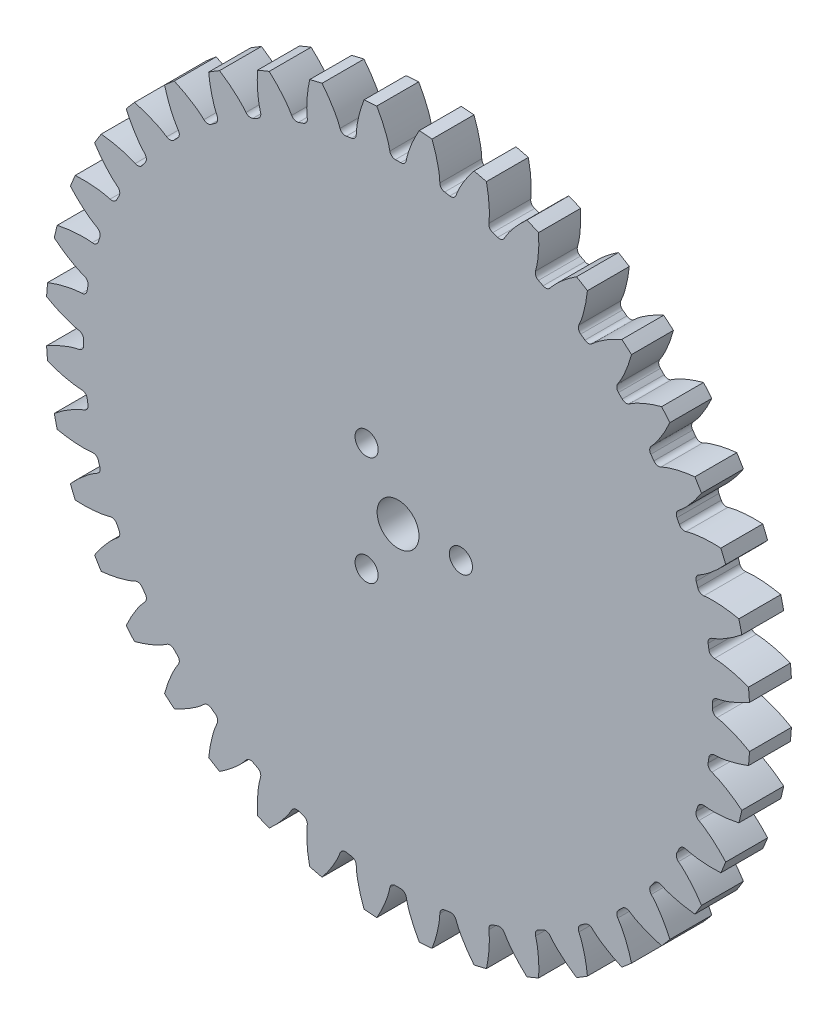
from build123d import *

# Parameters (mm, degrees)
BOSS_EXTRUDE1_DEPTH      = 3.175
BOSS_EXTRUDE1_DEPTH_BACK = 3.175
SKETCH3_R                = 53.34
CUT_EXTRUDE1_DEPTH       = 76.500939233
FILLET1_R                = 0.852182791
CIRPATTERN1_COUNT        = 40
FILLET1_OF_CIRPATTERN1_R = 0.852182791
SKETCH6_R                = 1.750000056
CUT_EXTRUDE2_DEPTH       = 76.56374835
SKETCH7_R                = 3.175
CUT_EXTRUDE3_DEPTH       = 76.56374835


with BuildPart() as part:
    # Sketch3 → Boss-Extrude1 (new, two sides: drawn at the far end of the back side and taken through both)
    with BuildSketch(Plane.XY.offset(-BOSS_EXTRUDE1_DEPTH_BACK)):
        Circle(SKETCH3_R)
    extrude(amount=BOSS_EXTRUDE1_DEPTH + BOSS_EXTRUDE1_DEPTH_BACK)

    # Sketch4 → Cut-Extrude1 (cut, symmetric)
    with BuildSketch(Plane.XY):
        with BuildLine():
            Line((47.610863724, 1.16029328), (47.722215798, 1.163006969))
            add(Edge.make_bspline(
                [(47.722215798, 1.163006969), (47.730982789, 1.163313167), (47.755564012, 1.16445845), (47.80200305, 1.167754997), (47.87772523, 1.174741096), (47.974119041, 1.186004909), (48.098593622, 1.203276497), (48.245061479, 1.227112329), (48.405834144, 1.256963367), (48.580520514, 1.293386204), (48.754577285, 1.333212779), (48.927987969, 1.376189951), (49.100522746, 1.421931459), (49.30925176, 1.48080125), (49.559155717, 1.556203831), (49.850651678, 1.651349023), (50.180503564, 1.767531099), (50.515821541, 1.894787282), (50.845048793, 2.027276114), (51.176798745, 2.169495413), (51.497150175, 2.313020498), (51.828924093, 2.470658837), (52.134675109, 2.620519189), (52.476090794, 2.797888155), (52.751288045, 2.94379105), (53.034579939, 3.102405155), (53.172312998, 3.180768911), (53.242640535, 3.221308569)],
                knots=[0, 0, 0, 0, 0, 0.005376749, 0.015083688, 0.02853182, 0.04661014, 0.064854849, 0.092110526, 0.119476176, 0.146842496, 0.174208854, 0.201574956, 0.228941013, 0.256307345, 0.307035032, 0.361767352, 0.416499661, 0.471231937, 0.525964282, 0.580696616, 0.635428982, 0.690161387, 0.744893688, 0.799626082, 0.854358407, 0.909090914, 0.909090914, 0.909090914, 0.909090914, 0.909090914], degree=4))
            ThreePointArc((53.242640535, 3.221308569), (53.34, 0), (53.242640535, -3.221308569))
            add(Edge.make_bspline(
                [(47.722215798, -1.163006969), (47.730982789, -1.163313167), (47.755564012, -1.16445845), (47.80200305, -1.167754997), (47.87772523, -1.174741096), (47.974119041, -1.186004909), (48.098593622, -1.203276497), (48.245061479, -1.227112329), (48.405834144, -1.256963367), (48.580520514, -1.293386204), (48.754577285, -1.333212779), (48.927987969, -1.376189951), (49.100522746, -1.421931459), (49.30925176, -1.48080125), (49.559155717, -1.556203831), (49.850651678, -1.651349023), (50.180503564, -1.767531099), (50.515821541, -1.894787282), (50.845048793, -2.027276114), (51.176798745, -2.169495413), (51.497150175, -2.313020498), (51.828924093, -2.470658837), (52.134675109, -2.620519189), (52.476090794, -2.797888155), (52.751288045, -2.94379105), (53.034579939, -3.102405155), (53.172312998, -3.180768911), (53.242640535, -3.221308569)],
                knots=[0, 0, 0, 0, 0, 0.005376749, 0.015083688, 0.02853182, 0.04661014, 0.064854849, 0.092110526, 0.119476176, 0.146842496, 0.174208854, 0.201574956, 0.228941013, 0.256307345, 0.307035032, 0.361767352, 0.416499661, 0.471231937, 0.525964282, 0.580696616, 0.635428982, 0.690161387, 0.744893688, 0.799626082, 0.854358407, 0.909090914, 0.909090914, 0.909090914, 0.909090914, 0.909090914], degree=4))
            Line((47.722215798, -1.163006969), (47.610863724, -1.16029328))
            ThreePointArc((47.610863724, -1.16029328), (47.625, 0), (47.610863724, 1.16029328))
        make_face()
    cut_extrude1 = extrude(amount=CUT_EXTRUDE1_DEPTH, both=True, mode=Mode.SUBTRACT)

    # Fillet1
    fillet1_edges = [part.edges().sort_by_distance(p)[0] for p in [
        (47.610863724, -1.16029328, 0),
        (47.610863724, 1.16029328, 0),
    ]]
    fillet(fillet1_edges, radius=FILLET1_R)

    # CirPattern1: Cut-Extrude1 ×40 about axis
    cirpattern1_axis = Axis((0, 0, 3.175), (0, 0, -1))
    for i in range(1, CIRPATTERN1_COUNT):
        add(cut_extrude1.rotate(cirpattern1_axis, i * 360 / CIRPATTERN1_COUNT), mode=Mode.SUBTRACT)

    # Fillet1 of CirPattern1
    fillet1_of_cirpattern1_edges = [part.edges().sort_by_distance(p)[0] for p in [
        (46.843185127, -8.593988141, 0),
        (47.206204844, -6.301971852, 0),
        (44.922071849, -15.816070492, 0),
        (45.639172533, -13.609061523, 0),
        (41.894828074, -22.648708697, 0),
        (42.948352326, -20.581050932, 0),
        (37.835994591, -28.923660528, 0),
        (39.200001148, -27.046266564, 0),
        (32.845513351, -34.486415844, 0),
        (34.486415844, -32.845513351, 0),
        (27.046266564, -39.200001148, 0),
        (28.923660528, -37.835994591, 0),
        (20.581050932, -42.948352326, 0),
        (22.648708697, -41.894828074, 0),
        (13.609061523, -45.639172533, 0),
        (15.816070492, -44.922071849, 0),
        (6.301971852, -47.206204844, 0),
        (8.593988141, -46.843185127, 0),
        (-1.16029328, -47.610863724, 0),
        (1.16029328, -47.610863724, 0),
        (-8.593988141, -46.843185127, 0),
        (-6.301971852, -47.206204844, 0),
        (-15.816070492, -44.922071849, 0),
        (-13.609061523, -45.639172533, 0),
        (-22.648708697, -41.894828074, 0),
        (-20.581050932, -42.948352326, 0),
        (-28.923660528, -37.835994591, 0),
        (-27.046266564, -39.200001148, 0),
        (-34.486415844, -32.845513351, 0),
        (-32.845513351, -34.486415844, 0),
        (-39.200001148, -27.046266564, 0),
        (-37.835994591, -28.923660528, 0),
        (-42.948352326, -20.581050932, 0),
        (-41.894828074, -22.648708697, 0),
        (-45.639172533, -13.609061523, 0),
        (-44.922071849, -15.816070492, 0),
        (-47.206204844, -6.301971852, 0),
        (-46.843185127, -8.593988141, 0),
        (-47.610863724, 1.16029328, 0),
        (-47.610863724, -1.16029328, 0),
        (-46.843185127, 8.593988141, 0),
        (-47.206204844, 6.301971852, 0),
        (-44.922071849, 15.816070492, 0),
        (-45.639172533, 13.609061523, 0),
        (-41.894828074, 22.648708697, 0),
        (-42.948352326, 20.581050932, 0),
        (-37.835994591, 28.923660528, 0),
        (-39.200001148, 27.046266564, 0),
        (-32.845513351, 34.486415844, 0),
        (-34.486415844, 32.845513351, 0),
        (-27.046266564, 39.200001148, 0),
        (-28.923660528, 37.835994591, 0),
        (-20.581050932, 42.948352326, 0),
        (-22.648708697, 41.894828074, 0),
        (-13.609061523, 45.639172533, 0),
        (-15.816070492, 44.922071849, 0),
        (-6.301971852, 47.206204844, 0),
        (-8.593988141, 46.843185127, 0),
        (1.16029328, 47.610863724, 0),
        (-1.16029328, 47.610863724, 0),
        (8.593988141, 46.843185127, 0),
        (6.301971852, 47.206204844, 0),
        (15.816070492, 44.922071849, 0),
        (13.609061523, 45.639172533, 0),
        (22.648708697, 41.894828074, 0),
        (20.581050932, 42.948352326, 0),
        (28.923660528, 37.835994591, 0),
        (27.046266564, 39.200001148, 0),
        (34.486415844, 32.845513351, 0),
        (32.845513351, 34.486415844, 0),
        (39.200001148, 27.046266564, 0),
        (37.835994591, 28.923660528, 0),
        (42.948352326, 20.581050932, 0),
        (41.894828074, 22.648708697, 0),
        (45.639172533, 13.609061523, 0),
        (44.922071849, 15.816070492, 0),
        (47.206204844, 6.301971852, 0),
        (46.843185127, 8.593988141, 0),
    ]]
    fillet(fillet1_of_cirpattern1_edges, radius=FILLET1_OF_CIRPATTERN1_R)

    # Sketch6 → Cut-Extrude2 (cut, through all)
    with BuildSketch(Plane.XY.offset(3.175)):
        with Locations((9.525, 0)):
            Circle(SKETCH6_R)
        with Locations((-4.7625, -8.248891971)):
            Circle(SKETCH6_R)
        with Locations((-4.7625, 8.248891971)):
            Circle(SKETCH6_R)
    extrude(amount=-CUT_EXTRUDE2_DEPTH, mode=Mode.SUBTRACT)

    # Sketch7 → Cut-Extrude3 (cut, through all)
    with BuildSketch(Plane.XY.offset(3.175)):
        Circle(SKETCH7_R)
    extrude(amount=-CUT_EXTRUDE3_DEPTH, mode=Mode.SUBTRACT)


solid = part.part
